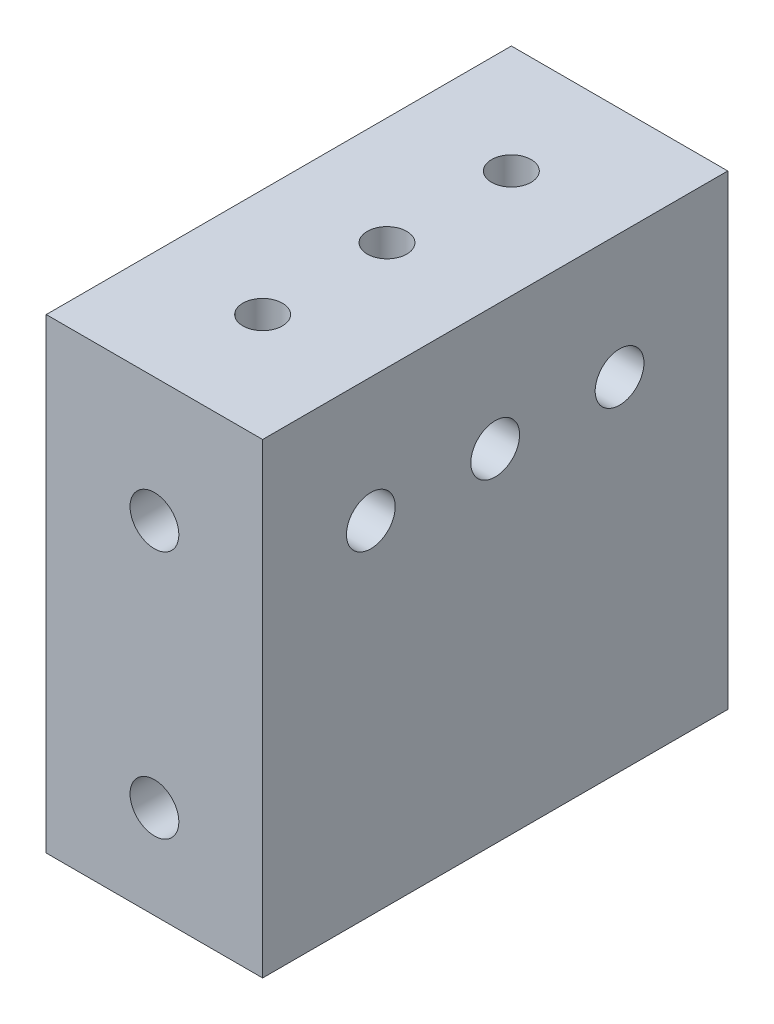
from build123d import *

# Parameters (mm, degrees)
SKETCH1_W           = 22.098
SKETCH1_H           = 47.498
BOSS_EXTRUDE1_DEPTH = 23.8125
SKETCH2_R           = 2.4892
CUT_EXTRUDE1_DEPTH  = 6.35
SKETCH5_R           = 2.4892
CUT_EXTRUDE2_DEPTH  = 55.269471724
SKETCH6_R           = 2.0193
CUT_EXTRUDE3_DEPTH  = 6.35


with BuildPart() as part:
    # Sketch1 → Boss-Extrude1 (new, symmetric)
    with BuildSketch(Plane(origin=(0, 0, 0), x_dir=(1, 0, 0), z_dir=(0, 1, 0))):
        Rectangle(SKETCH1_W, SKETCH1_H)
    extrude(amount=BOSS_EXTRUDE1_DEPTH, both=True)

    # Sketch2 → Cut-Extrude1 (cut)
    with BuildSketch(Plane(origin=(11.049, 0, 0), x_dir=(0, 0, -1), z_dir=(1, 0, 0))):
        with Locations((-12.7, 11.1125)):
            Circle(SKETCH2_R)
        with Locations((0, 11.1125)):
            Circle(SKETCH2_R)
        with Locations((12.7, 11.1125)):
            Circle(SKETCH2_R)
    extrude(amount=-CUT_EXTRUDE1_DEPTH, mode=Mode.SUBTRACT)

    # Sketch5 → Cut-Extrude2 (cut, through all)
    with BuildSketch(Plane(origin=(0, 0, -23.749), x_dir=(-1, 0, 0), z_dir=(0, 0, -1))):
        with Locations((0, 11.1125)):
            Circle(SKETCH5_R)
        with Locations((0, -14.2875)):
            Circle(SKETCH5_R)
    extrude(amount=-CUT_EXTRUDE2_DEPTH, mode=Mode.SUBTRACT)

    # Sketch6 → Cut-Extrude3 (cut)
    with BuildSketch(Plane(origin=(0, 23.8125, 0), x_dir=(1, 0, 0), z_dir=(0, 1, 0))):
        Circle(SKETCH6_R)
        with Locations((0, 12.7)):
            Circle(SKETCH6_R)
        with Locations((0, -12.7)):
            Circle(SKETCH6_R)
    extrude(amount=-CUT_EXTRUDE3_DEPTH, mode=Mode.SUBTRACT)


solid = part.part
